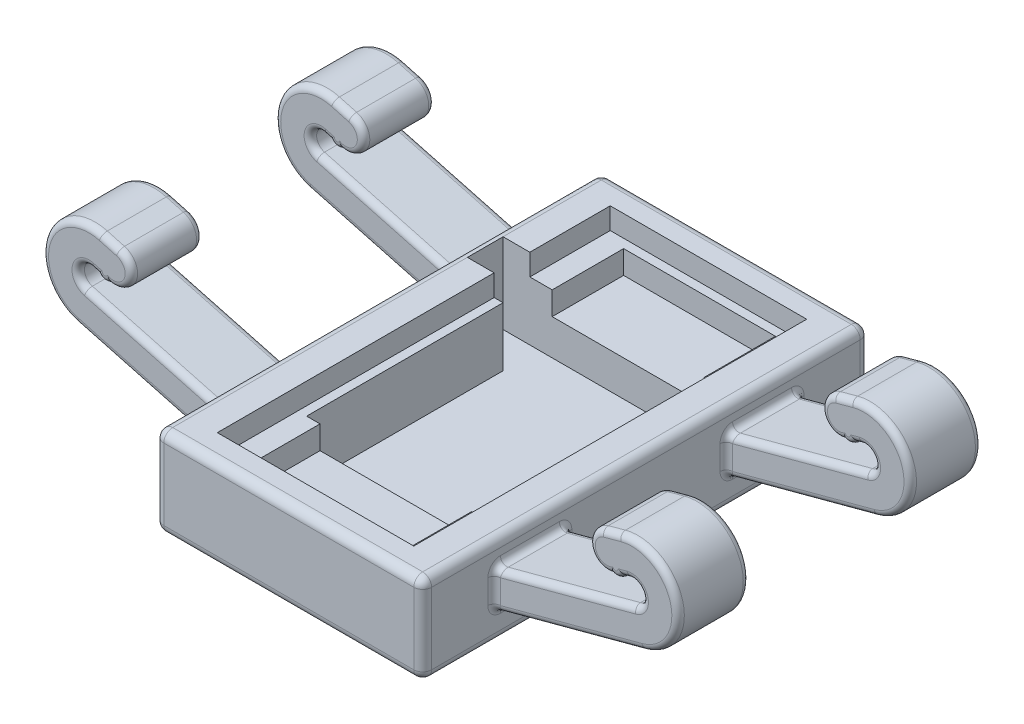
from build123d import *

# Parameters (mm, degrees)
SKETCH1_W            = 38.1
SKETCH1_H            = 63.5
BOSS_EXTRUDE1_DEPTH  = 12.7
SKETCH3_W            = 21.59
SKETCH3_H            = 53.34
CUT_EXTRUDE2_DEPTH   = 6.35
BOSS_EXTRUDE2_START  = -53.34
BOSS_EXTRUDE2_DEPTH  = 10.16
FILLET1_R            = 1.27
FILLET2_R            = 0.889
MIRROR2_START        = -53.34
MIRROR2_COPY_1_DEPTH = 10.16
MIRROR2_COPY_2_DEPTH = 10.16
CUT_EXTRUDE1_DEPTH   = 11.43
FILLET3_R            = 0.889
SKETCH5_W            = 27.94
SKETCH5_H            = 55.88
CUT_EXTRUDE3_DEPTH   = 3.048


with BuildPart() as part:
    # Sketch1 → Boss-Extrude1 (new body)
    with BuildSketch(Plane(origin=(0, 0, 0), x_dir=(1, 0, 0), z_dir=(0, 1, 0))):
        Rectangle(SKETCH1_W, SKETCH1_H)
    extrude(amount=-BOSS_EXTRUDE1_DEPTH)

    # Sketch3 → Cut-Extrude2 (cut)
    with BuildSketch(Plane(origin=(0, 0, 0), x_dir=(1, 0, 0), z_dir=(0, 1, 0))):
        Rectangle(SKETCH3_W, SKETCH3_H)
    extrude(amount=-CUT_EXTRUDE2_DEPTH, mode=Mode.SUBTRACT)

    # Sketch4 → Boss-Extrude2 (add)
    with BuildSketch(Plane.XY.offset(31.75).offset(BOSS_EXTRUDE2_START)):
        with BuildLine():
            Line((-18.58035428, -8.803451599), (-40.311747214, -2.980542412))
            ThreePointArc((-40.311747214, -2.980542412), (-44.981912315, 5.134599363), (-36.853744709, 9.782056674))
            Line((-36.853744709, 9.782056674), (-34.41205134, 9.113150776))
            ThreePointArc((-34.41205134, 9.113150776), (-32.631212781, 5.998123223), (-35.741462419, 4.208953072))
            ThreePointArc((-35.741462419, 4.208953072), (-36.645111345, 4.114856063), (-37.380391274, 4.648521741))
            Line((-37.380391274, 4.648521741), (-38.186701698, 4.864778108))
            ThreePointArc((-38.186701698, 4.864778108), (-40.053516933, 3.78741705), (-38.97593325, 1.920730312))
            Line((-38.97593325, 1.920730312), (-17.265553531, -3.896548401))
            Line((-17.265553531, -3.896548401), (-18.58035428, -8.803451599))
        make_face()
    boss_extrude2 = extrude(amount=BOSS_EXTRUDE2_DEPTH)

    # Mirror1: Boss-Extrude2 across plane
    add(boss_extrude2.mirror(Plane.XY))

    # Fillet1
    fillet1_edges = [part.edges().sort_by_distance(p)[0] for p in [
        (0, -12.7, -31.75),
        (-19.05, -12.7, 0),
        (0, -12.7, 31.75),
        (19.05, -12.7, 0),
        (19.05, -6.35, -31.75),
        (-19.05, -6.35, -31.75),
        (19.05, -6.35, 31.75),
        (-19.05, -6.35, 31.75),
        (19.05, 0, 0),
        (0, 0, -31.75),
        (0, 0, 31.75),
        (-19.05, 0, 0),
    ]]
    fillet(fillet1_edges, radius=FILLET1_R)

    # Fillet2
    fillet2_edges = [part.edges().sort_by_distance(p)[0] for p in [
        (-19.05, -3.418407411, 16.51),
        (-19.05, -8.677610407, 16.51),
        (-19.05, -8.677610407, -16.51),
        (-19.05, -3.418407411, -16.51),
        (-29.012966625, -0.74883855, 11.43),
        (-40.053516933, 3.78741705, 11.43),
        (-37.783546486, 4.756649924, 11.43),
        (-36.645111345, 4.114856063, 11.43),
        (-32.631212781, 5.998123223, 11.43),
        (-35.632898025, 9.447603725, 11.43),
        (-44.981912315, 5.134599363, 11.43),
        (-29.680873607, -5.82907641, 11.43),
        (-19.05, -6.048008909, 11.43),
        (-40.053516933, 3.78741705, -21.59),
        (-37.783546486, 4.756649924, -21.59),
        (-36.645111345, 4.114856063, -21.59),
        (-32.631212781, 5.998123223, -21.59),
        (-35.632898025, 9.447603725, -21.59),
        (-44.981912315, 5.134599363, -21.59),
        (-29.680873607, -5.82907641, -21.59),
        (-19.05, -6.048008909, -21.59),
        (-29.012966625, -0.74883855, -21.59),
        (-44.981912315, 5.134599363, 21.59),
        (-35.632898025, 9.447603725, 21.59),
        (-32.631212781, 5.998123223, 21.59),
        (-36.645111345, 4.114856063, 21.59),
        (-37.783546486, 4.756649924, 21.59),
        (-40.053516933, 3.78741705, 21.59),
        (-29.012966625, -0.74883855, 21.59),
        (-19.05, -6.048008909, 21.59),
        (-29.680873607, -5.82907641, 21.59),
        (-29.680873607, -5.82907641, -11.43),
        (-44.981912315, 5.134599363, -11.43),
        (-35.632898025, 9.447603725, -11.43),
        (-32.631212781, 5.998123223, -11.43),
        (-36.645111345, 4.114856063, -11.43),
        (-37.783546486, 4.756649924, -11.43),
        (-40.053516933, 3.78741705, -11.43),
        (-29.012966625, -0.74883855, -11.43),
        (-19.05, -6.048008909, -11.43),
    ]]
    fillet(fillet2_edges, radius=FILLET2_R)

    # Mirror2 copy 1 sketch → Mirror2 copy 1 (add)
    with BuildSketch(Plane(origin=(0, 0, -31.75), x_dir=(-1, 0, 0), z_dir=(0, 0, -1)).offset(MIRROR2_START)):
        with BuildLine():
            Line((-18.58035428, -8.803451599), (-40.311747214, -2.980542412))
            ThreePointArc((-40.311747214, -2.980542412), (-44.981912315, 5.134599363), (-36.853744709, 9.782056674))
            Line((-36.853744709, 9.782056674), (-34.41205134, 9.113150776))
            ThreePointArc((-34.41205134, 9.113150776), (-32.631212781, 5.998123223), (-35.741462419, 4.208953072))
            ThreePointArc((-35.741462419, 4.208953072), (-36.645111345, 4.114856063), (-37.380391274, 4.648521741))
            Line((-37.380391274, 4.648521741), (-38.186701698, 4.864778108))
            ThreePointArc((-38.186701698, 4.864778108), (-40.053516933, 3.78741705), (-38.97593325, 1.920730312))
            Line((-38.97593325, 1.920730312), (-17.265553531, -3.896548401))
            Line((-17.265553531, -3.896548401), (-18.58035428, -8.803451599))
        make_face()
    extrude(amount=MIRROR2_COPY_1_DEPTH)

    # Mirror2 copy 2 sketch → Mirror2 copy 2 (add)
    with BuildSketch(Plane(origin=(0, 0, 31.75), x_dir=(-1, 0, 0), z_dir=(0, 0, 1)).offset(MIRROR2_START)):
        with BuildLine():
            Line((-18.58035428, 8.803451599), (-40.311747214, 2.980542412))
            ThreePointArc((-40.311747214, 2.980542412), (-44.981912315, -5.134599363), (-36.853744709, -9.782056674))
            Line((-36.853744709, -9.782056674), (-34.41205134, -9.113150776))
            ThreePointArc((-34.41205134, -9.113150776), (-32.631212781, -5.998123223), (-35.741462419, -4.208953072))
            ThreePointArc((-35.741462419, -4.208953072), (-36.645111345, -4.114856063), (-37.380391274, -4.648521741))
            Line((-37.380391274, -4.648521741), (-38.186701698, -4.864778108))
            ThreePointArc((-38.186701698, -4.864778108), (-40.053516933, -3.78741705), (-38.97593325, -1.920730312))
            Line((-38.97593325, -1.920730312), (-17.265553531, 3.896548401))
            Line((-17.265553531, 3.896548401), (-18.58035428, 8.803451599))
        make_face()
    extrude(amount=MIRROR2_COPY_2_DEPTH)

    # Sketch2 → Cut-Extrude1 (cut)
    with BuildSketch(Plane(origin=(0, 0, 0), x_dir=(1, 0, 0), z_dir=(0, 1, 0))):
        Polygon((12.7, 16.51), (-17.78, 16.51), (-17.78, 11.43), (-12.7, 11.43), (-12.7, -16.51), (12.7, -16.51), align=None)
    extrude(amount=-CUT_EXTRUDE1_DEPTH, mode=Mode.SUBTRACT)

    # Fillet3
    fillet3_edges = [part.edges().sort_by_distance(p)[0] for p in [
        (19.05, -3.418407411, -16.51),
        (19.05, -8.677610407, -16.51),
        (19.05, -8.677610407, 16.51),
        (19.05, -3.418407411, 16.51),
        (44.981912315, 5.134599363, -21.59),
        (35.632898025, 9.447603725, -21.59),
        (32.631212781, 5.998123223, -21.59),
        (36.645111345, 4.114856063, -21.59),
        (37.783546486, 4.756649924, -21.59),
        (40.053516933, 3.78741705, -21.59),
        (29.012966625, -0.74883855, -21.59),
        (19.05, -6.048008909, -21.59),
        (29.680873607, -5.82907641, -21.59),
        (29.680873607, -5.82907641, 11.43),
        (44.981912315, 5.134599363, 11.43),
        (35.632898025, 9.447603725, 11.43),
        (32.631212781, 5.998123223, 11.43),
        (36.645111345, 4.114856063, 11.43),
        (37.783546486, 4.756649924, 11.43),
        (40.053516933, 3.78741705, 11.43),
        (29.012966625, -0.74883855, 11.43),
        (19.05, -6.048008909, 11.43),
        (29.012966625, -0.74883855, -11.43),
        (40.053516933, 3.78741705, -11.43),
        (37.783546486, 4.756649924, -11.43),
        (36.645111345, 4.114856063, -11.43),
        (32.631212781, 5.998123223, -11.43),
        (35.632898025, 9.447603725, -11.43),
        (44.981912315, 5.134599363, -11.43),
        (29.680873607, -5.82907641, -11.43),
        (19.05, -6.048008909, -11.43),
        (40.053516933, 3.78741705, 21.59),
        (37.783546486, 4.756649924, 21.59),
        (36.645111345, 4.114856063, 21.59),
        (32.631212781, 5.998123223, 21.59),
        (35.632898025, 9.447603725, 21.59),
        (44.981912315, 5.134599363, 21.59),
        (29.680873607, -5.82907641, 21.59),
        (19.05, -6.048008909, 21.59),
        (29.012966625, -0.74883855, 21.59),
    ]]
    fillet(fillet3_edges, radius=FILLET3_R)

    # Sketch5 → Cut-Extrude3 (cut)
    with BuildSketch(Plane(origin=(0, 0, 0), x_dir=(1, 0, 0), z_dir=(0, 1, 0))):
        Rectangle(SKETCH5_W, SKETCH5_H)
    extrude(amount=-CUT_EXTRUDE3_DEPTH, mode=Mode.SUBTRACT)


solid = part.part
